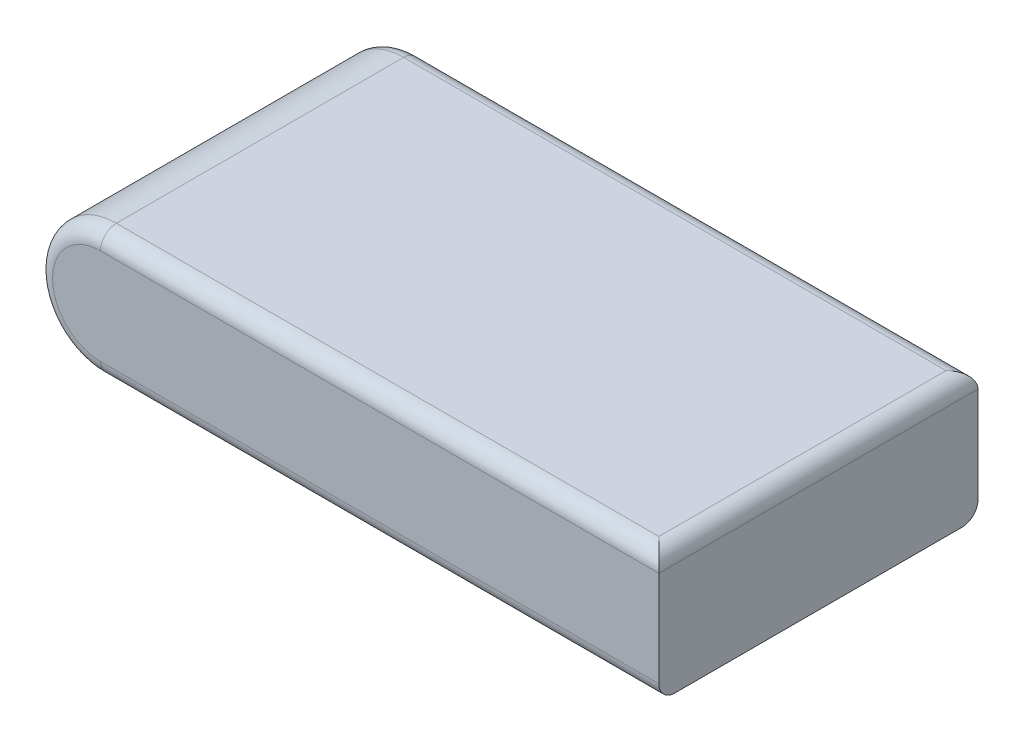
from build123d import *

# Parameters (mm, degrees)
EXTRUDE_1_DEPTH = 20
FILLET_1_R      = 1


with BuildPart() as part:
    # Эскиз1 → Бобышка-Вытянуть1 (new body)
    with BuildSketch(Plane.XY):
        with BuildLine():
            Line((17.5, -4), (-17.5, -4))
            ThreePointArc((-17.5, -4), (-21.5, 0), (-17.5, 4))
            Line((-17.5, 4), (17.5, 4))
            Line((17.5, 4), (17.5, -4))
        make_face()
    extrude(amount=EXTRUDE_1_DEPTH)

    # Скругление1
    fillet_1_edges = [part.edges().sort_by_distance(p)[0] for p in [
        (0, -4, 20),
        (-21.5, 0, 20),
        (0, -4, 0),
        (-21.5, 0, 0),
        (17.5, 4, 10),
        (0, 4, 20),
        (0, 4, 0),
    ]]
    fillet(fillet_1_edges, radius=FILLET_1_R)


solid = part.part
